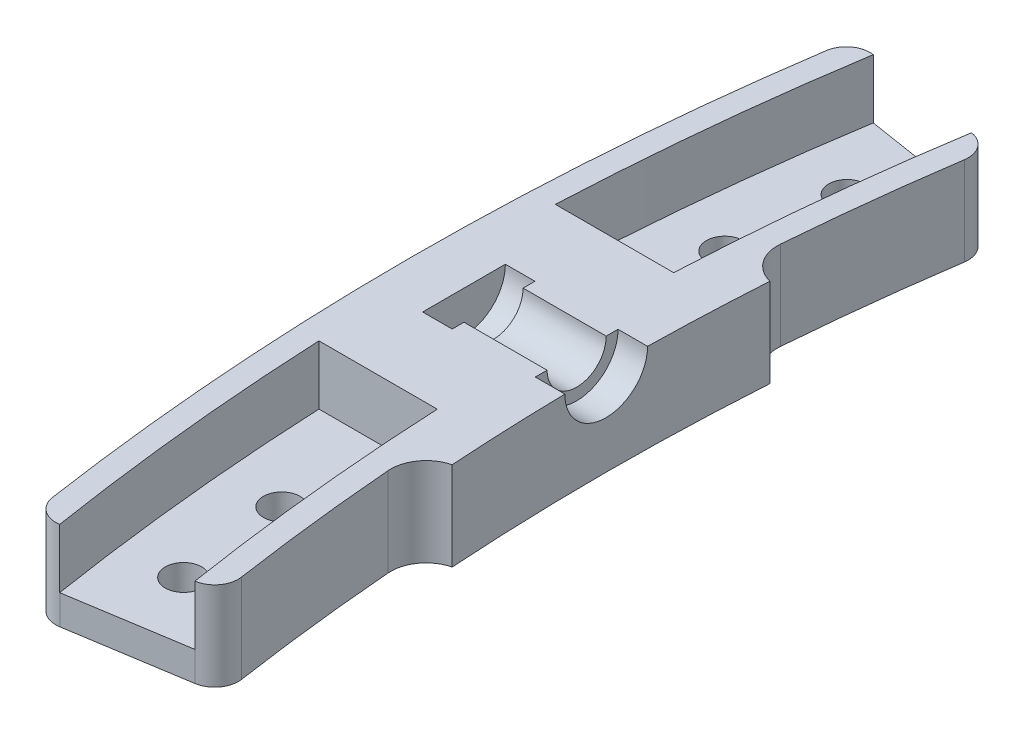
from build123d import *

# Parameters (mm, degrees)
BOSS_EXTRUDE1_DEPTH        = 10
CUT_EXTRUDE1_DEPTH         = 5
F_3_1_3_1_DIAMETER_HOLE2_D = 3.1
BOSS_EXTRUDE2_DEPTH        = 10
FILLET1_R                  = 3
FILLET2_R                  = 2
CUT_EXTRUDE6_DEPTH         = 2.5
SKETCH28_R                 = 3.5000000000000004
CUT_EXTRUDE7_DEPTH         = 2.5
SKETCH29_W                 = 2.5
SKETCH29_H                 = 3.5000000000000004
SKETCH30_R                 = 2.5000000000000004
CUT_EXTRUDE8_DEPTH         = 7.029807515


with BuildPart() as part:
    # Sketch1 → Boss-Extrude1 (new body)
    with BuildSketch(Plane(origin=(0, 0, 0), x_dir=(1, 0, 0), z_dir=(0, 1, 0))):
        with BuildLine():
            ThreePointArc((-207.41455152497886, 32.851237658448525), (-209.99999999999994, 2.572e-14), (-207.41455152497886, -32.85123765844857))
            Line((-207.41455152497886, -32.85123765844857), (-217.29143493093028, -34.41558230885091))
            ThreePointArc((-217.29143493093028, -34.41558230885091), (-220, 2.694e-14), (-217.29143493093028, 34.415582308850865))
            Line((-217.29143493093028, 34.415582308850865), (-207.41455152497886, 32.851237658448525))
        make_face()
        with BuildLine():
            ThreePointArc((-217.2914349309303, -34.415582308850915), (-219.99999999999997, -1.421e-14), (-217.2914349309303, 34.415582308850865))
            Line((-217.29143493093028, 34.41558230885082), (-219.26681161212053, 34.72845123893128))
            ThreePointArc((-219.26681161212053, 34.72845123893128), (-221.99999999999997, -2.665e-14), (-219.26681161212053, -34.72845123893134))
            Line((-219.26681161212053, -34.728451238931335), (-217.29143493093028, -34.41558230885088))
        make_face()
        with BuildLine():
            Line((-205.4391748437886, 32.538368728368056), (-207.41455152497886, 32.85123765844851))
            ThreePointArc((-207.41455152497886, 32.851237658448525), (-209.99999999999994, -2.132e-14), (-207.41455152497886, -32.85123765844859))
            Line((-207.41455152497886, -32.85123765844857), (-205.4391748437886, -32.53836872836811))
            ThreePointArc((-205.43917484378863, -32.53836872836813), (-207.99999999999997, -2.842e-14), (-205.43917484378863, 32.538368728368056))
        make_face()
    extrude(amount=BOSS_EXTRUDE1_DEPTH)

    # Sketch15 → Cut-Extrude1 (cut)
    with BuildSketch(Plane(origin=(0, 10, 0), x_dir=(1, 0, 0), z_dir=(0, 1, 0))):
        with BuildLine():
            Line((-219.7726097583591, 9.999999999999972), (-209.76176963403066, 9.999999999999972))
            ThreePointArc((-209.76176963403046, 9.999999999995824), (-208.90085088283388, 21.457737542154447), (-207.41455152497886, 32.851237658448504))
            Line((-207.41455152497886, 32.851237658448504), (-217.29143493093028, 34.41558230885091))
            ThreePointArc((-217.2914349309303, 34.41558230885091), (-218.8727368927212, 22.242415450882426), (-219.7726097583591, 10.000000000000421))
        make_face()
        with BuildLine():
            ThreePointArc((-207.4145515249789, -32.85123765844855), (-208.90085088283385, -21.457737542154504), (-209.76176963403046, -9.999999999995891))
            Line((-209.76176963403066, -10.000000000000028), (-219.77260975835907, -10.00000000000003))
            ThreePointArc((-219.7726097583591, -10.000000000000506), (-218.8727368927212, -22.242415450882447), (-217.2914349309303, -34.41558230885088))
            Line((-217.29143493093028, -34.41558230885086), (-207.41455152497886, -32.85123765844855))
        make_face()
    extrude(amount=-CUT_EXTRUDE1_DEPTH, mode=Mode.SUBTRACT)

    # Ø3.1 (3.1) Diameter Hole2 (through all)
    with Locations(Plane(origin=(0, 0, 0), x_dir=(-1, 0, 0), z_dir=(0, -1, 0))):
        with Locations((213.160645195, -28.063131327), (214.18186009, -18.738484691), (214.18186009, 18.738484691), (213.160645195, 28.063131327)):
            Hole(F_3_1_3_1_DIAMETER_HOLE2_D / 2)

    # Sketch19 → Boss-Extrude2 (add)
    with BuildSketch(Plane(origin=(0, 0, 0), x_dir=(1, 0, 0), z_dir=(0, 1, 0))):
        with BuildLine():
            Line((-205.06000872553298, -13.44034305679455), (-207.55465603362947, -13.603850879869908))
            ThreePointArc((-207.55465603362947, -13.603850879869908), (-207.99999999999994, 2.547e-14), (-207.55465603362947, 13.603850879869857))
            Line((-207.55465603362947, 13.603850879869857), (-205.06000872553298, 13.440343056794502))
            ThreePointArc((-205.06000872553298, 13.440343056794502), (-205.49999999999997, 2.517e-14), (-205.06000872553298, -13.44034305679455))
        make_face()
    extrude(amount=BOSS_EXTRUDE2_DEPTH)

    # Fillet1
    # the kernel refuses this fillet: 3 mm, written as the material it adds along each edge
    with BuildSketch(Plane(origin=(-207.5546560336295, 0, -13.60385087986986), x_dir=(0.07259195171826252, 0, -0.9973617240228008), z_dir=(0, 1, 0))) as fillet1_piece_1:
        with BuildLine():
            CenterArc((2.97605695844059, -2.9999221104362666), FILLET1_R, 89.58712595875737, 80.81905726138756)
            Line((0.01801487263020066, -2.4999350920302814), (-0.04114596908600657, -2.489935351662162))
            ThreePointArc((-0.04114596908600657, -2.489935351662162), (-0.05099100589383556, -1.2503999029582549), (-0.05999844220872477, -0.00043235694312724))
            Line((-0.05999844220872477, -0.00043235694312724), (-0.00043235694311419, 0.05999844220871681))
            ThreePointArc((-0.00043235694311419, 0.05999844220871681), (1.4988374027981592, 0.06540034308590705), (2.998107162539448, 0.05999844220873665))
            Line((2.998107162539448, 0.05999844220873665), (2.9976748055963345, 1e-17))
        make_face()
    extrude(amount=10)
    with BuildSketch(Plane(origin=(-207.5546560336295, 0, 13.60385087986991), x_dir=(0.07259195171826295, 0, 0.9973617240228008), z_dir=(0, 1, 0))) as fillet1_piece_2:
        with BuildLine():
            CenterArc((2.9760569584405734, 2.9999221104362666), FILLET1_R, 189.5938167798556, 80.819057261387)
            Line((0.01801487263018374, 2.4999350920302543), (-0.04114596908602352, 2.4899353516621354))
            ThreePointArc((-0.04114596908602352, 2.4899353516621354), (-0.05099100589383325, 1.2503999029582546), (-0.05999844220872477, 0.00043235694312726))
            Line((-0.05999844220872477, 0.00043235694312726), (-0.00043235694311422, -0.05999844220871681))
            ThreePointArc((-0.00043235694311422, -0.05999844220871681), (1.498837402798161, -0.06540034308590782), (2.9981071625394304, -0.05999844220873665))
            Line((2.9981071625394304, -0.05999844220873665), (2.9976748055963167, 0))
        make_face()
    extrude(amount=10)

    # Fillet2
    fillet2_edges = [part.edges().sort_by_distance(p)[0] for p in [
        (-219.26681161212053, 5, 34.72845123893134),
        (-219.26681161212053, 5, -34.728451238931285),
        (-205.43917484378863, 5, -32.538368728368056),
        (-205.43917484378863, 5, 32.53836872836813),
    ]]
    fillet(fillet2_edges, radius=FILLET2_R)

    # Sketch26 → Cut-Extrude6 (cut)
    with BuildSketch(Plane.XZ):
        with BuildLine():
            Line((-217.28245576049179, -34.41416014796698), (-207.40514475604385, -32.849747772616084))
            ThreePointArc((-207.40514475604385, -32.849747772616084), (-206.1055960612061, -32.057633278286005), (-205.73974688911358, -30.580329461983652))
            ThreePointArc((-205.73974688911358, -30.580329461983652), (-206.65676096006328, -23.600490450312087), (-207.33704896887454, -16.593616992039934))
            ThreePointArc((-207.33704896887454, -16.593616992039934), (-206.7787671555463, -14.597978692482226), (-205.06000872553278, -13.440343056794774))
            ThreePointArc((-205.06000872553278, -13.440343056794774), (-205.5, -6.609e-14), (-205.060008725533, 13.440343056794593))
            ThreePointArc((-205.060008725533, 13.440343056794593), (-206.77876715554575, 14.597978692481712), (-207.3370489688746, 16.593616992038744))
            ThreePointArc((-207.3370489688746, 16.593616992038744), (-206.6567609600633, 23.60049045031153), (-205.73974688911358, 30.580329461983624))
            ThreePointArc((-205.73974688911358, 30.580329461983624), (-206.10559606120609, 32.057633278286005), (-207.40514475604385, 32.84974777261609))
            Line((-207.40514475604385, 32.84974777261609), (-217.28245576049179, 34.41416014796698))
            ThreePointArc((-217.28245576049179, 34.41416014796698), (-218.7782378264501, 34.05145718237069), (-219.57346400594108, 32.7336814982928))
            ThreePointArc((-219.57346400594108, 32.7336814982928), (-221.99999999999994, 1.2577e-13), (-219.5734640059411, -32.733681498292746))
            ThreePointArc((-219.5734640059411, -32.733681498292746), (-218.7782378264501, -34.051457182370655), (-217.28245576049179, -34.41416014796698))
        make_face()
    extrude(amount=-CUT_EXTRUDE6_DEPTH, mode=Mode.SUBTRACT)

    # Sketch28 → Cut-Extrude7 (cut)
    with BuildSketch(Plane(origin=(-217.5, 0, 0), x_dir=(0, 0, -1), z_dir=(1, 0, 0))):
        with Locations((-2.082e-14, 10)):
            Circle(SKETCH28_R)
    extrude(amount=CUT_EXTRUDE7_DEPTH, mode=Mode.SUBTRACT)

    # Sketch29 → Cut-Revolve1 (revolve, cut)
    with BuildSketch(Plane(origin=(0, 10, 0), x_dir=(1, 0, 0), z_dir=(0, 1, 0))):
        with Locations((-206.72019248543083, -1.7500000000000002)):
            Rectangle(SKETCH29_W, SKETCH29_H)
    revolve(axis=Axis((-217.5, 10, 1.53e-15), (1, 0, -1.2e-16)), mode=Mode.SUBTRACT)

    # Sketch30 → Cut-Extrude8 (cut)
    with BuildSketch(Plane(origin=(-207.97019248543083, 0, 2.547e-14), x_dir=(-1.2e-16, 0, -1), z_dir=(1, 0, -1.2e-16))):
        with Locations((2.515e-14, 10)):
            Circle(SKETCH30_R)
    extrude(amount=-CUT_EXTRUDE8_DEPTH, mode=Mode.SUBTRACT)


solid = part.part
